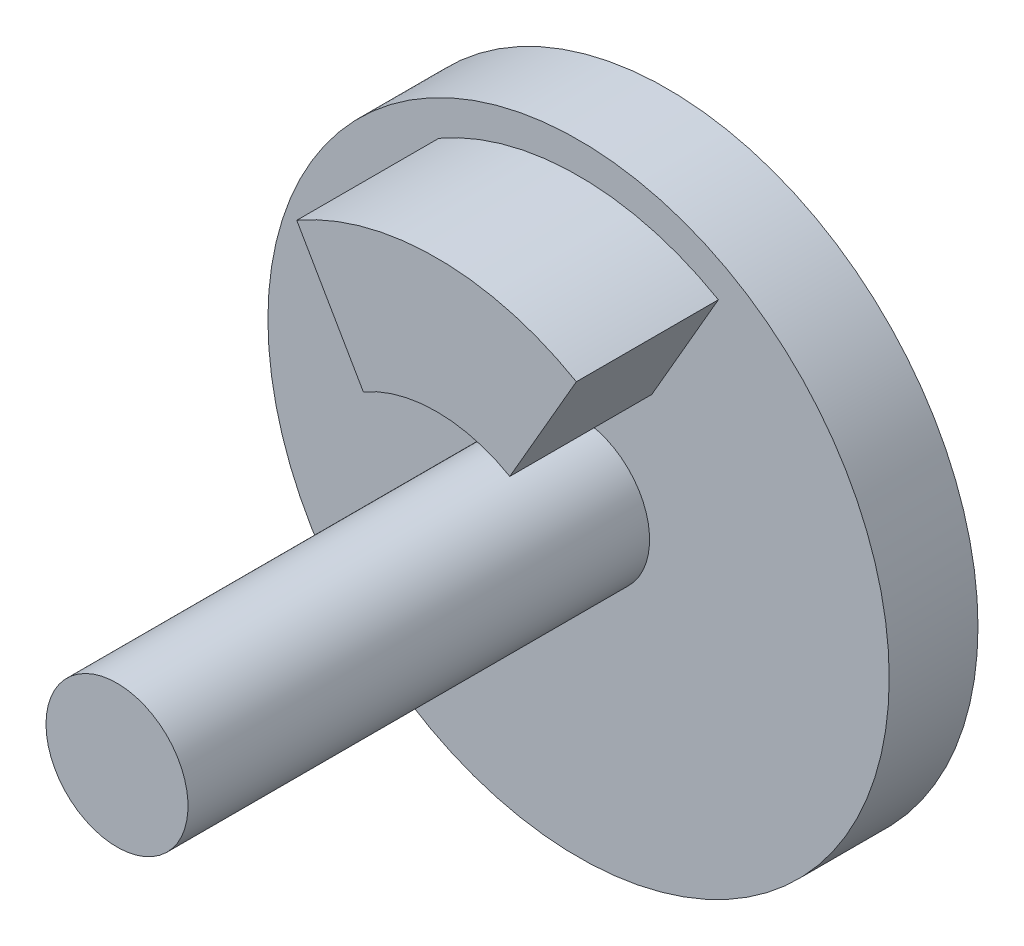
from build123d import *

# Parameters (mm, degrees)
SKETCH1_R           = 17.5
BOSS_EXTRUDE1_DEPTH = 2.5
BOSS_EXTRUDE2_DEPTH = 8
SKETCH3_R           = 4
BOSS_EXTRUDE3_DEPTH = 26
SKETCH4_R           = 3
BOSS_EXTRUDE4_DEPTH = 10


with BuildPart() as part:
    # Sketch1 → Boss-Extrude1 (new, symmetric)
    with BuildSketch(Plane.XY):
        Circle(SKETCH1_R)
    extrude(amount=BOSS_EXTRUDE1_DEPTH, both=True)

    # Sketch2 → Boss-Extrude2 (add)
    with BuildSketch(Plane.XY.offset(2.5)):
        with BuildLine():
            Line((7.875, 13.63990011), (4.125, 7.144709581))
            ThreePointArc((4.125, 7.144709581), (0, 8.25), (-4.125, 7.144709581))
            Line((-4.125, 7.144709581), (-7.875, 13.63990011))
            ThreePointArc((-7.875, 13.63990011), (0, 15.75), (7.875, 13.63990011))
        make_face()
    extrude(amount=BOSS_EXTRUDE2_DEPTH)

    # Sketch3 → Boss-Extrude3 (add)
    with BuildSketch(Plane.XY.offset(2.5)):
        Circle(SKETCH3_R)
    extrude(amount=BOSS_EXTRUDE3_DEPTH)

    # Sketch4 → Boss-Extrude4 (add)
    with BuildSketch(Plane(origin=(0, 0, -2.5), x_dir=(-1, 0, 0), z_dir=(0, 0, -1))):
        Circle(SKETCH4_R)
    extrude(amount=BOSS_EXTRUDE4_DEPTH)


solid = part.part
